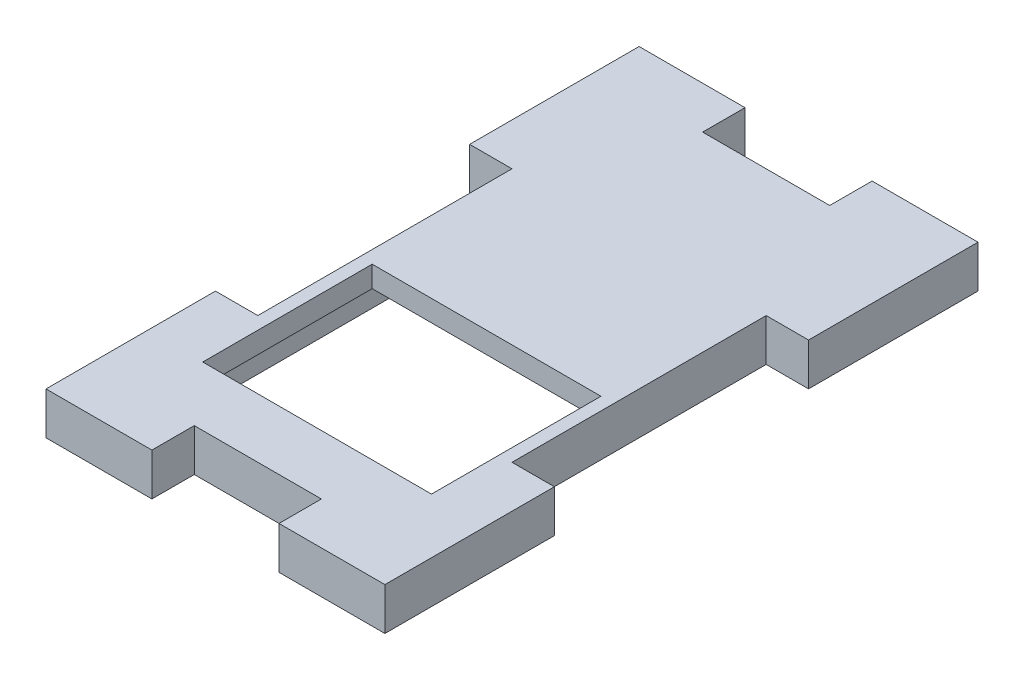
from build123d import *

# Parameters (mm, degrees)
SKETCH1_W               = 40
SKETCH1_H               = 70
SKETCH1_W_2             = 27
SKETCH1_H_2             = 20
BOSS_EXTRUDE1_DEPTH     = 5
SKETCH2_W               = 28
SKETCH2_H               = 28
CUT_EXTRUDE1_DEPTH      = 2.5
SKETCH4_W               = 21.5
SKETCH4_H               = 19.5
CUT_EXTRUDE2_DEPTH      = 2.5
CUT_EXTRUDE3_DEPTH      = 81.777472107
CUT_EXTRUDE3_DEPTH_BACK = 81.777472107
SKETCH5_W               = 5
SKETCH5_H               = 30
SKETCH5_W_2             = 15
SKETCH5_H_2             = 5


with BuildPart() as part:
    # Sketch1 → Boss-Extrude1 (new body)
    with BuildSketch(Plane(origin=(0, 0, 0), x_dir=(1, 0, 0), z_dir=(0, 1, 0))):
        with Locations((20, 35)):
            Rectangle(SKETCH1_W, SKETCH1_H)
        with Locations((20, 22)):
            Rectangle(SKETCH1_W_2, SKETCH1_H_2, mode=Mode.SUBTRACT)
    extrude(amount=BOSS_EXTRUDE1_DEPTH)

    # Sketch2 → Cut-Extrude1 (cut)
    with BuildSketch(Plane.XZ):
        with Locations((20, -22)):
            Rectangle(SKETCH2_W, SKETCH2_H)
    extrude(amount=-CUT_EXTRUDE1_DEPTH, mode=Mode.SUBTRACT)

    # Sketch4 → Cut-Extrude2 (cut)
    with BuildSketch(Plane.XZ):
        with Locations((20, -51.25)):
            Rectangle(SKETCH4_W, SKETCH4_H)
    extrude(amount=-CUT_EXTRUDE2_DEPTH, mode=Mode.SUBTRACT)

    # Sketch5 → Cut-Extrude3 (cut, two sides: drawn at the far end of the back side and taken through both)
    with BuildSketch(Plane(origin=(0, 5, 0), x_dir=(1, 0, 0), z_dir=(0, 1, 0)).offset(-CUT_EXTRUDE3_DEPTH_BACK)):
        with Locations((2.5, 35)):
            Rectangle(SKETCH5_W, SKETCH5_H)
        with Locations((20, 67.5)):
            Rectangle(SKETCH5_W_2, SKETCH5_H_2)
        with Locations((37.5, 35)):
            Rectangle(SKETCH5_W, SKETCH5_H)
        with Locations((20, 2.5)):
            Rectangle(SKETCH5_W_2, SKETCH5_H_2)
    extrude(amount=CUT_EXTRUDE3_DEPTH + CUT_EXTRUDE3_DEPTH_BACK, mode=Mode.SUBTRACT)


solid = part.part
